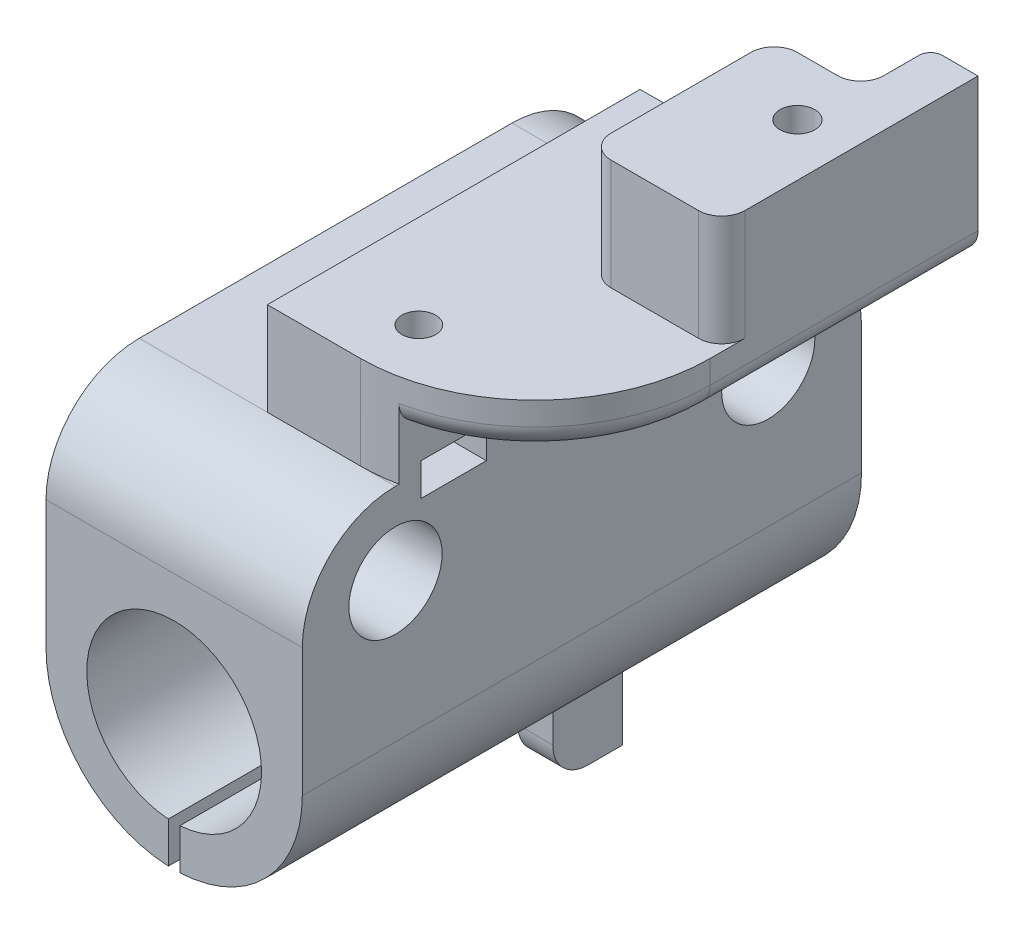
from build123d import *

# Parameters (mm, degrees)
EXTRUDE_1_DEPTH          = 48
CUT_EXTRUDE_1_DEPTH      = 60.304300013
CUT_EXTRUDE_1_DEPTH_BACK = 60.304300013
SKETCH_3_R               = 4
CUT_EXTRUDE_2_DEPTH      = 60.304300013
CUT_EXTRUDE_2_DEPTH_BACK = 60.304300013
SKETCH_4_R               = 4
SKETCH_5_W               = 48
SKETCH_5_H               = 4
EXTRUDE_3_DEPTH          = 12
CUT_EXTRUDE_3_DEPTH      = 66.39217114
CUT_EXTRUDE_3_DEPTH_BACK = 25
CUT_EXTRUDE_3_START      = 15
SKETCH_7_R               = 1.45
CUT_EXTRUDE_4_DEPTH      = 66.39217114
CUT_EXTRUDE_4_DEPTH_BACK = 66.39217114
CUT_EXTRUDE_5_DEPTH      = 8
SKETCH_10_R              = 1.5
CUT_EXTRUDE_6_DEPTH      = 10
SKETCH_11_W              = 5.6
SKETCH_11_H              = 2.8
CUT_EXTRUDE_7_DEPTH      = 10
SKETCH_13_R              = 1.5
EXTRUDE_4_DEPTH          = 9.5
FILLET_2_R               = 15
FILLET_4_R               = 8
FILLET_5_R               = 2
EXTRUDE_5_DEPTH          = 6
FILLET_6_R               = 2
FILLET_7_R               = 1
EXTRUDE_START            = -9
SKETCH_15_W              = 3
SKETCH_15_H              = 14
EXTRUDE_6_DEPTH          = 6
FILLET_8_R               = 3
SKETCH_16_W              = 5.6
SKETCH_16_H              = 2.8
CUT_EXTRUDE_8_DEPTH      = 7
CUT_EXTRUDE_9_DEPTH      = 2.5
CUT_EXTRUDE_9_DRAFT      = -5


# Some blends are built 0.0001 mm under size
with BuildPart() as part:
    # Эскиз2 → Бобышка-Вытянуть1 (new body)
    with BuildSketch(Plane.XY):
        with BuildLine():
            Line((0.5, -7.483314774), (0.5, -10.988630488))
            ThreePointArc((0.5, -10.988630488), (7.95298686, -7.599342077), (11, 0))
            Line((11, 0), (11, 27))
            Line((11, 27), (-11, 27))
            Line((-11, 27), (-11, 0))
            ThreePointArc((-11, 0), (-7.95298686, -7.599342077), (-0.5, -10.988630488))
            Line((-0.5, -10.988630488), (-0.5, -7.483314774))
            ThreePointArc((-0.5, -7.483314774), (0, 7.5), (0.5, -7.483314774))
        make_face()
    extrude(amount=EXTRUDE_1_DEPTH)

    # Эскиз3 → Вырез-Вытянуть1 (cut, two sides: drawn at the far end of the back side and taken through both)
    with BuildSketch(Plane(origin=(11, 0, 0), x_dir=(0, 0, -1), z_dir=(1, 0, 0)).offset(-CUT_EXTRUDE_1_DEPTH_BACK)):
        with Locations((-40, 12)):
            Circle(SKETCH_3_R)
    extrude(amount=CUT_EXTRUDE_1_DEPTH + CUT_EXTRUDE_1_DEPTH_BACK, mode=Mode.SUBTRACT)

    # Эскиз4 → Вырез-Вытянуть2 (cut, two sides: drawn at the far end of the back side and taken through both)
    with BuildSketch(Plane(origin=(11, 0, 0), x_dir=(0, 0, -1), z_dir=(1, 0, 0)).offset(-CUT_EXTRUDE_2_DEPTH_BACK)):
        with Locations((-8, 12)):
            Circle(SKETCH_4_R)
    extrude(amount=CUT_EXTRUDE_2_DEPTH + CUT_EXTRUDE_2_DEPTH_BACK, mode=Mode.SUBTRACT)

    # Эскиз5 → Бобышка-Вытянуть3 (add)
    with BuildSketch(Plane(origin=(11, 0, 0), x_dir=(0, 0, -1), z_dir=(1, 0, 0))):
        with Locations((-24, 25)):
            Rectangle(SKETCH_5_W, SKETCH_5_H)
    extrude(amount=EXTRUDE_3_DEPTH)

    # Эскиз7 → Вырез-Вытянуть3 (cut, two sides: drawn at the far end of the back side and taken through both)
    with BuildSketch(Plane(origin=(0, 27, 0), x_dir=(1, 0, 0), z_dir=(0, 1, 0)).offset(CUT_EXTRUDE_3_START - CUT_EXTRUDE_3_DEPTH_BACK)):
        with Locations(Location((8, -35, 0), (0, 0, 270))):
            Circle(SKETCH_7_R)
        with Locations(Location((18.5, -13, 0), (0, 0, 270))):
            Circle(SKETCH_7_R)
    extrude(amount=CUT_EXTRUDE_3_DEPTH + CUT_EXTRUDE_3_DEPTH_BACK, mode=Mode.SUBTRACT)

    # Эскиз8 → Вырез-Вытянуть4 (cut, two sides: drawn at the far end of the back side and taken through both)
    with BuildSketch(Plane(origin=(0, 27, 0), x_dir=(1, 0, 0), z_dir=(0, 1, 0)).offset(-CUT_EXTRUDE_4_DEPTH_BACK)):
        with BuildLine():
            Line((23, -48), (20, -48))
            ThreePointArc((20, -48), (22.121320344, -47.121320344), (23, -45))
            Line((23, -45), (23, -48))
        make_face()
        with BuildLine():
            Line((23, 0), (23, -3))
            ThreePointArc((23, -3), (22.121320344, -0.878679656), (20, 0))
            Line((20, 0), (23, 0))
        make_face()
    extrude(amount=CUT_EXTRUDE_4_DEPTH + CUT_EXTRUDE_4_DEPTH_BACK, mode=Mode.SUBTRACT)

    # Эскиз9 → Вырез-Вытянуть5 (cut)
    with BuildSketch(Plane(origin=(0, 27, 0), x_dir=(1, 0, 0), z_dir=(0, 1, 0))):
        Polygon((-11, -48), (23, -48), (23, -40), (0, -40), (0, -8), (23, -8), (23, 0), (-11, 0), (-11, -8), (-11, -40), align=None)
    extrude(amount=-CUT_EXTRUDE_5_DEPTH, mode=Mode.SUBTRACT)

    # Эскиз10 → Вырез-Вытянуть6 (cut)
    with BuildSketch(Plane(origin=(0, 19, 0), x_dir=(1, 0, 0), z_dir=(0, 1, 0))):
        with Locations(Location((-5.5, -24, 0), (0, 0, 270))):
            Circle(SKETCH_10_R)
    extrude(amount=-CUT_EXTRUDE_6_DEPTH, mode=Mode.SUBTRACT)

    # Эскиз11 → Вырез-Вытянуть7 (cut)
    with BuildSketch(Plane.ZY.offset(11)):
        with Locations((24, 12.6)):
            Rectangle(SKETCH_11_W, SKETCH_11_H)
    extrude(amount=-CUT_EXTRUDE_7_DEPTH, mode=Mode.SUBTRACT)

    # Эскиз13 → Бобышка-Вытянуть4 (add)
    with BuildSketch(Plane(origin=(0, 27, 0), x_dir=(1, 0, 0), z_dir=(0, 1, 0))):
        with BuildLine():
            Line((21, -8), (13.5, -8))
            ThreePointArc((13.5, -8), (12.085786438, -8.585786438), (11.5, -10))
            Line((11.5, -10), (11.5, -22))
            ThreePointArc((11.5, -22), (12.085786438, -23.414213562), (13.5, -24))
            Line((13.5, -24), (21, -24))
            ThreePointArc((21, -24), (22.414213562, -23.414213562), (23, -22))
            Line((23, -22), (23, -10))
            Line((23, -10), (23, -8))
            Line((23, -8), (21, -8))
        make_face()
        with Locations(Location((18.5, -13, 0), (0, 0, 270))):
            Circle(SKETCH_13_R, mode=Mode.SUBTRACT)
    extrude(amount=EXTRUDE_4_DEPTH)

    # Скругление2
    # the kernel refuses this fillet: 15 mm, written as the material it takes off along each edge
    with BuildSketch(Plane(origin=(23, 64.5, 40), x_dir=(-1, 0, 0), z_dir=(0, -1, 0))) as fillet_2_piece_1_section:
        with BuildLine():
            CenterArc((FILLET_2_R, FILLET_2_R), FILLET_2_R, 180, 90)
            Line((0, FILLET_2_R), (0, 0))
            Line((0, 0), (FILLET_2_R, 0))
        make_face()
    fillet_2_piece_1 = extrude(amount=79, mode=Mode.PRIVATE)
    fillet_2_piece_1 = split(fillet_2_piece_1, bisect_by=Plane(origin=(10.251523637, 19, 39.909241185), z_dir=(0, 1, 0)), keep=Keep.TOP, mode=Mode.PRIVATE)
    add(fillet_2_piece_1, mode=Mode.SUBTRACT)

    # Скругление4
    fillet_4_edges = [part.edges().sort_by_distance(p)[0] for p in [
        (0, 19, 48),
        (0, 19, 0),
    ]]
    fillet(fillet_4_edges, radius=FILLET_4_R - 0.0001)  # a hair under: the kernel refuses the full size

    # Скругление5
    fillet_5_edges = [part.edges().sort_by_distance(p)[0] for p in [
        (23, 23, 16.5),
        (19.618950039, 23, 34.486832981),
    ]]
    fillet(fillet_5_edges, radius=FILLET_5_R)

    # Эскиз14 → Бобышка-Вытянуть5 (add)
    with BuildSketch(Plane(origin=(0, 0, 8), x_dir=(-1, 0, 0), z_dir=(0, 0, -1))):
        with BuildLine():
            Line((-23, 36.5), (-18.933112149, 36.5))
            Line((-18.933112149, 36.5), (-18.933112149, 23))
            Line((-18.933112149, 23), (-21, 23))
            ThreePointArc((-21, 23), (-22.414213562, 23.585786438), (-23, 25))
            Line((-23, 25), (-23, 36.5))
        make_face()
    extrude(amount=EXTRUDE_5_DEPTH)

    # Скругление6
    fillet_6_edges = [part.edges().sort_by_distance(p)[0] for p in [
        (18.933112149, 29.75, 8),
    ]]
    fillet(fillet_6_edges, radius=FILLET_6_R)

    # Скругление7
    fillet_7_edges = [part.edges().sort_by_distance(p)[0] for p in [
        (18.933112149, 29.75, 2),
    ]]
    fillet(fillet_7_edges, radius=FILLET_7_R)

    # Эскиз15 → Бобышка-Вытянуть6 (add)
    with BuildSketch(Plane(origin=(0, 0, 0), x_dir=(-1, 0, 0), z_dir=(0, 0, -1)).offset(EXTRUDE_START)):
        with Locations((2, -14.483314774)):
            Rectangle(SKETCH_15_W, SKETCH_15_H)
    extrude(amount=-EXTRUDE_6_DEPTH)

    # Скругление8
    fillet_8_edges = [part.edges().sort_by_distance(p)[0] for p in [
        (-2, -21.483314774, 15),
    ]]
    fillet(fillet_8_edges, radius=FILLET_8_R)

    # Эскиз16 → Вырез-Вытянуть8 (cut)
    with BuildSketch(Plane(origin=(11, 0, 0), x_dir=(0, 0, -1), z_dir=(1, 0, 0))):
        with Locations((-35, 18.4)):
            Rectangle(SKETCH_16_W, SKETCH_16_H)
    extrude(amount=-CUT_EXTRUDE_8_DEPTH, mode=Mode.SUBTRACT)


with BuildPart() as cut_extrude_9_tool:
    # Эскиз19 → Вырез-Вытянуть9 (with draft: the straight prism first)
    with BuildSketch(Plane.XZ.offset(-23)):
        Polygon((18.5, 16.175426481), (15.75, 14.58771324), (15.75, 11.41228676), (18.5, 9.824573519), (21.25, 11.41228676), (21.25, 14.58771324), align=None)
    extrude(amount=-CUT_EXTRUDE_9_DEPTH)
    # Вырез-Вытянуть9: the draft: its side faces are tilted about the plane it starts from
    cut_extrude_9_sides = [cut_extrude_9_tool.faces().sort_by_distance(p)[0] for p in [
        (17.125, 24.25, 15.38156986),
        (15.75, 24.25, 13),
        (17.125, 24.25, 10.61843014),
        (19.875, 24.25, 10.61843014),
        (21.25, 24.25, 13),
        (19.875, 24.25, 15.38156986),
    ]]
    draft(cut_extrude_9_sides, Plane.XZ.offset(-23), CUT_EXTRUDE_9_DRAFT)


with BuildPart() as part_1:
    add(part.part)

    # Вырез-Вытянуть9: cut by cut_extrude_9_tool
    add(cut_extrude_9_tool.part, mode=Mode.SUBTRACT)


solid = part_1.part
